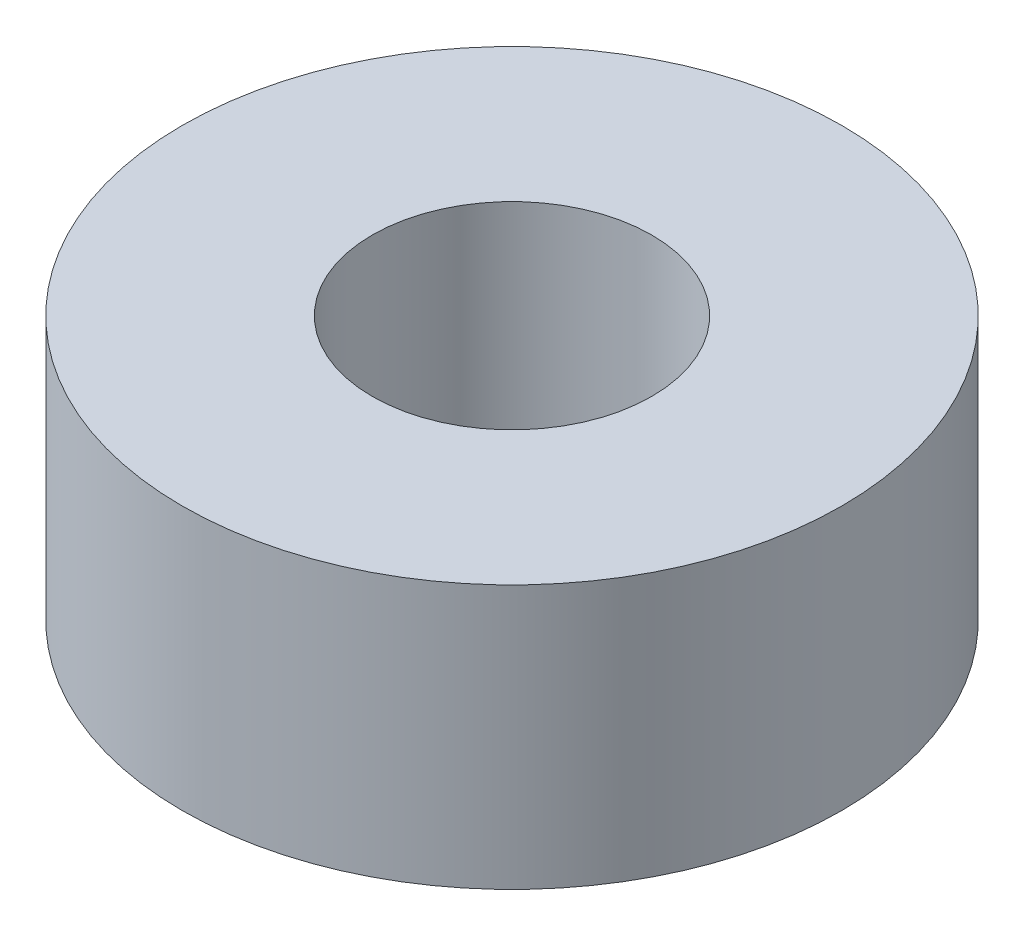
from build123d import *

# Parameters (mm, degrees)
SKETCH1_R           = 7.9375
SKETCH1_R_2         = 3.3655
BOSS_EXTRUDE1_DEPTH = 6.35


with BuildPart() as part:
    # Sketch1 → Boss-Extrude1 (new body)
    with BuildSketch(Plane(origin=(0, 0, 0), x_dir=(1, 0, 0), z_dir=(0, 1, 0))):
        Circle(SKETCH1_R)
        Circle(SKETCH1_R_2, mode=Mode.SUBTRACT)
    extrude(amount=BOSS_EXTRUDE1_DEPTH)


solid = part.part
